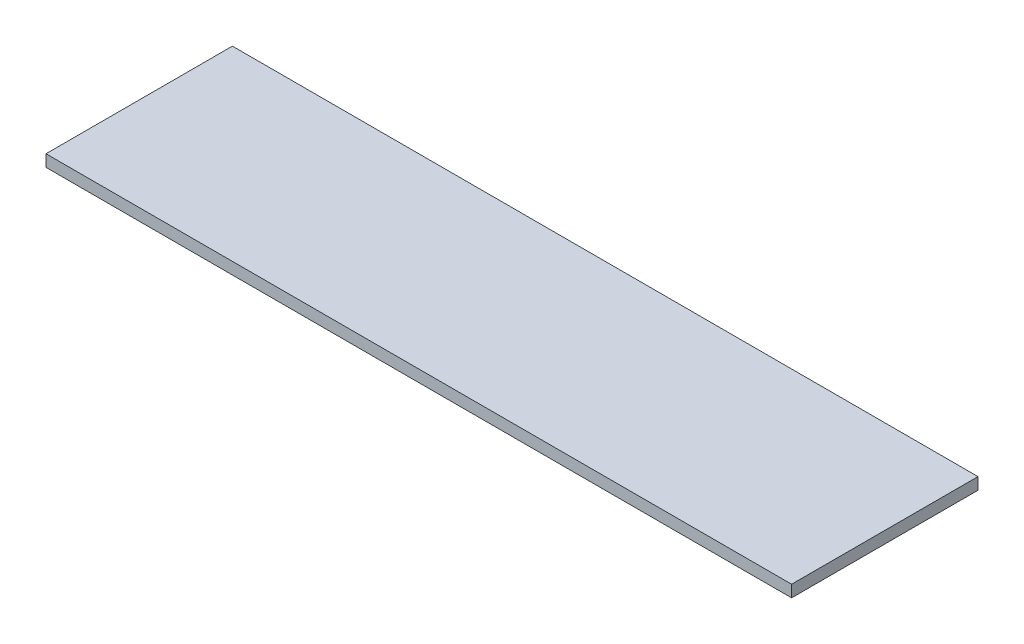
from build123d import *

# Parameters (mm, degrees)
SKETCH1_W           = 200
SKETCH1_H           = 50
BOSS_EXTRUDE1_DEPTH = 3.175


with BuildPart() as part:
    # Sketch1 → Boss-Extrude1 (new body)
    with BuildSketch(Plane(origin=(0, 0, 0), x_dir=(1, 0, 0), z_dir=(0, 1, 0))):
        with Locations((100, -25)):
            Rectangle(SKETCH1_W, SKETCH1_H)
    extrude(amount=BOSS_EXTRUDE1_DEPTH)


solid = part.part
